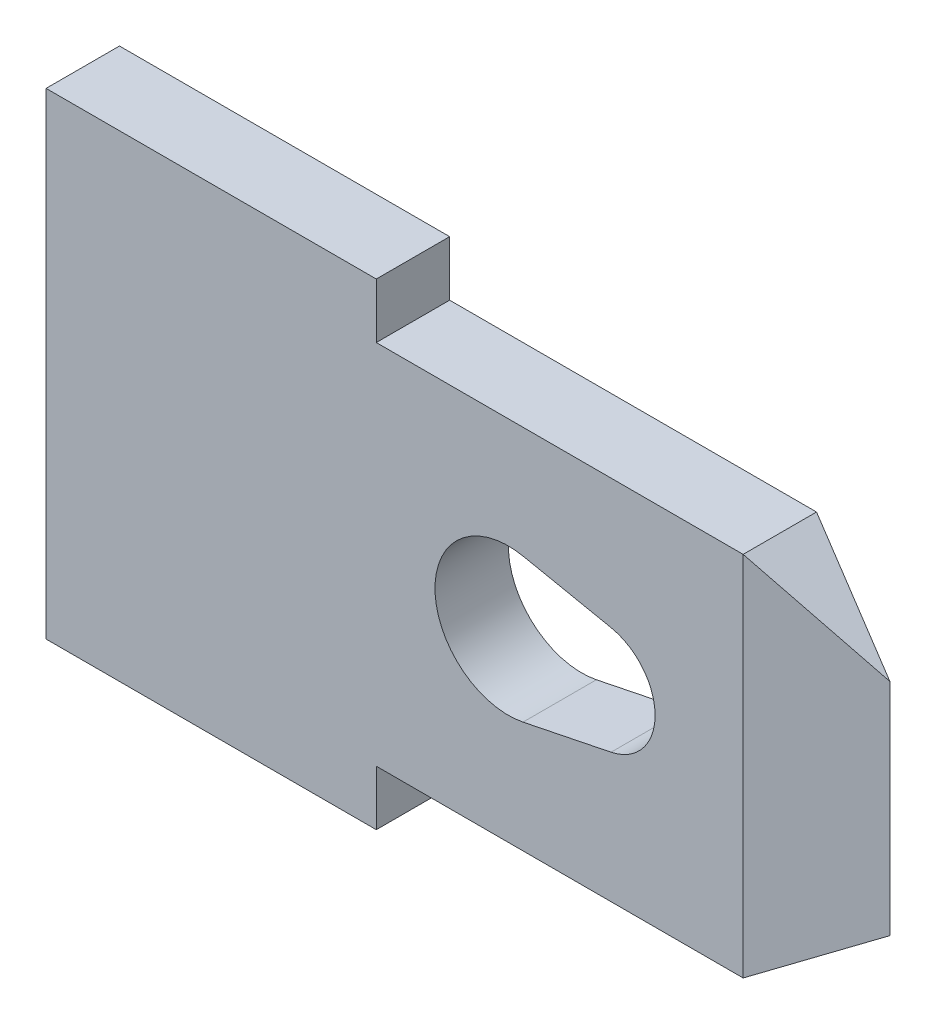
from build123d import *

# Parameters (mm, degrees)
DODANIE_WYCI_GNI_CIE1_DEPTH = 1
WYTNIJ_WYCI_GNI_CIE1_REACH  = 13.514
WYTNIJ_WYCI_GNI_CIE2_REACH  = 14.452


with BuildPart() as part:
    # Szkic1 → Dodanie-wyciągnięcie1 (new body)
    with BuildSketch(Plane.XY):
        Polygon((0, -3.25), (0, 3.25), (4.5, 3.25), (4.5, 2.5), (9.5, 2.5), (11, 1.5), (11, -1.5), (9.5, -2.5), (4.5, -2.5), (4.5, -3.25), align=None)
    extrude(amount=DODANIE_WYCI_GNI_CIE1_DEPTH)

    # Szkic2 → Wytnij-wyciągnięcie1 (cut, up to next)
    with BuildSketch(Plane.XY.offset(1), mode=Mode.PRIVATE) as wytnij_wyci_gni_cie1_sk1:
        with BuildLine():
            Line((6.5, 0.979795897), (7.7, 0.734846923))
            ThreePointArc((7.7, 0.734846923), (8.3, 0), (7.7, -0.734846923))
            Line((7.7, -0.734846923), (6.5, -0.979795897))
            ThreePointArc((6.5, -0.979795897), (5.3, 0), (6.5, 0.979795897))
        make_face()
    wytnij_wyci_gni_cie1_tool1 = extrude(wytnij_wyci_gni_cie1_sk1.sketch, amount=-WYTNIJ_WYCI_GNI_CIE1_REACH, mode=Mode.PRIVATE) & part.part
    add(wytnij_wyci_gni_cie1_tool1.solids().sort_by_distance((6.737463, 0, 1))[0], mode=Mode.SUBTRACT)

    # Szkic3 → Wytnij-wyciągnięcie2 (cut, up to next)
    with BuildSketch(Plane(origin=(0, 2.5, 0), x_dir=(1, 0, 0), z_dir=(0, 1, 0)), mode=Mode.PRIVATE) as wytnij_wyci_gni_cie2_sk1:
        Polygon((11, -1), (11, -0.5), (9.5, -1), align=None)
    wytnij_wyci_gni_cie2_tool1 = extrude(wytnij_wyci_gni_cie2_sk1.sketch, amount=-WYTNIJ_WYCI_GNI_CIE2_REACH, mode=Mode.PRIVATE) & part.part
    # Szkic3 → Wytnij-wyciągnięcie2 (cut, up to next)
    with BuildSketch(Plane(origin=(0, 2.5, 0), x_dir=(1, 0, 0), z_dir=(0, 1, 0)), mode=Mode.PRIVATE) as wytnij_wyci_gni_cie2_sk2:
        Polygon((9.5, 0), (11, -0.5), (11, 0), align=None)
    wytnij_wyci_gni_cie2_tool2 = extrude(wytnij_wyci_gni_cie2_sk2.sketch, amount=-WYTNIJ_WYCI_GNI_CIE2_REACH, mode=Mode.PRIVATE) & part.part
    add(wytnij_wyci_gni_cie2_tool1.solids().sort_by_distance((10.5, 2.5, 0.833333))[0], mode=Mode.SUBTRACT)
    add(wytnij_wyci_gni_cie2_tool2.solids().sort_by_distance((10.5, 2.5, 0.166667))[0], mode=Mode.SUBTRACT)


solid = part.part
